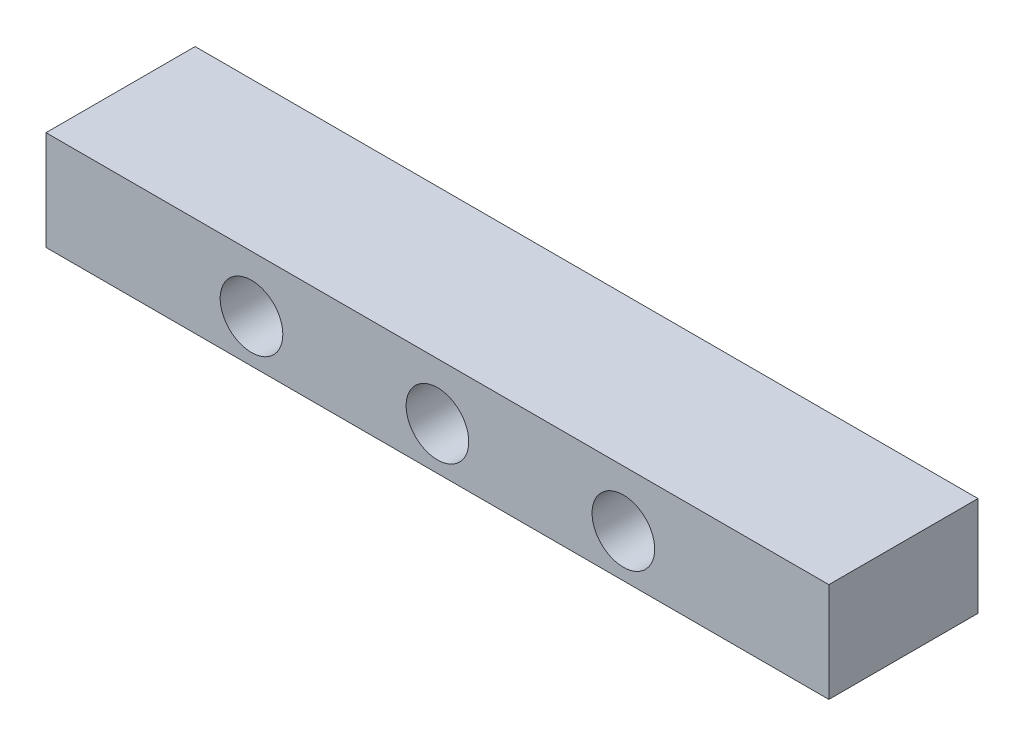
from build123d import *

# Parameters (mm, degrees)
SKETCH1_W           = 400
SKETCH1_H           = 76.2
BOSS_EXTRUDE1_DEPTH = 50.8
SKETCH2_R           = 16
CUT_EXTRUDE1_DEPTH  = 76.2


with BuildPart() as part:
    # Sketch1 → Boss-Extrude1 (new body)
    with BuildSketch(Plane(origin=(0, 0, 0), x_dir=(1, 0, 0), z_dir=(0, 1, 0))):
        with Locations((200, 38.1)):
            Rectangle(SKETCH1_W, SKETCH1_H)
    extrude(amount=BOSS_EXTRUDE1_DEPTH)

    # Sketch2 → Cut-Extrude1 (cut)
    with BuildSketch(Plane.XY):
        with Locations((105, 22)):
            Circle(SKETCH2_R)
        with Locations((200, 22)):
            Circle(SKETCH2_R)
        with Locations((295, 22)):
            Circle(SKETCH2_R)
    extrude(amount=-CUT_EXTRUDE1_DEPTH, mode=Mode.SUBTRACT)


solid = part.part
